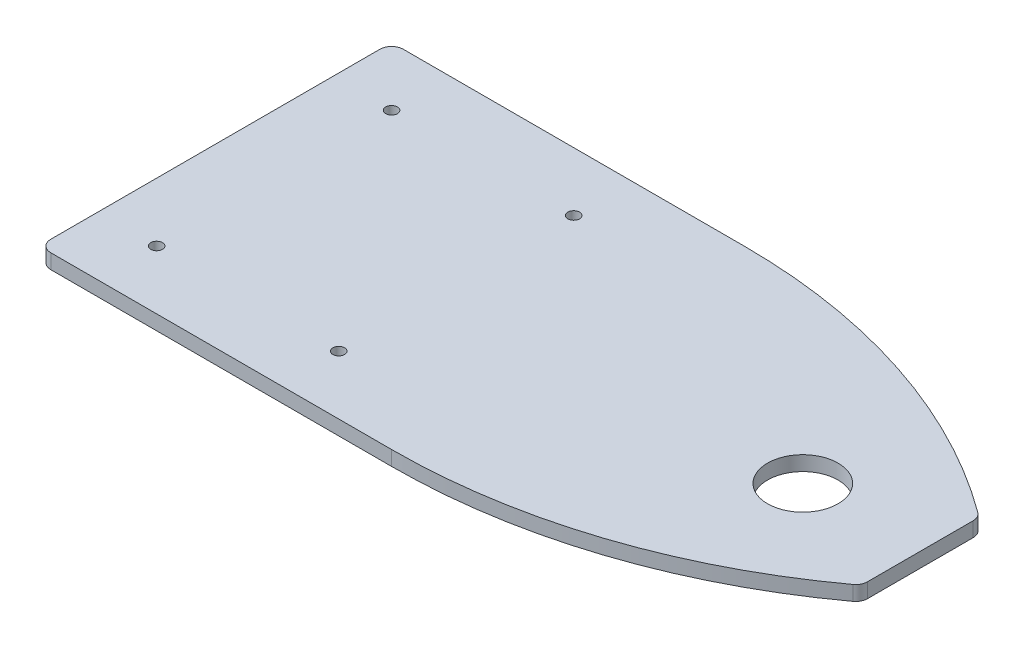
from build123d import *

# Parameters (mm, degrees)
SKETCH1_W           = 152.4
SKETCH1_H           = 76.2
BOSS_EXTRUDE1_DEPTH = 3.175
CUT_EXTRUDE1_DEPTH  = 3.175
FILLET2_R           = 2.54
FILLET3_R           = 2.54
SKETCH5_R           = 7.62
CUT_EXTRUDE2_DEPTH  = 3.175
SKETCH6_R           = 1.27
CUT_EXTRUDE3_DEPTH  = 3.175


with BuildPart() as part:
    # Sketch1 → Boss-Extrude1 (new body)
    with BuildSketch(Plane(origin=(0, 0, 0), x_dir=(1, 0, 0), z_dir=(0, 1, 0))):
        Rectangle(SKETCH1_W, SKETCH1_H)
    extrude(amount=BOSS_EXTRUDE1_DEPTH)

    # Sketch4 → Cut-Extrude1 (cut)
    with BuildSketch(Plane(origin=(0, 3.175, 0), x_dir=(1, 0, 0), z_dir=(0, 1, 0))):
        with BuildLine():
            Line((0, 38.1), (76.2, 38.1))
            Line((76.2, 38.1), (76.2, 12.7))
            ThreePointArc((76.2, 12.7), (40.160926284, 31.582778852), (0, 38.1))
        make_face()
        with BuildLine():
            Line((76.2, -38.1), (76.2, -12.7))
            ThreePointArc((76.2, -12.7), (40.160926284, -31.582778852), (0, -38.1))
            Line((0, -38.1), (76.2, -38.1))
        make_face()
    extrude(amount=-CUT_EXTRUDE1_DEPTH, mode=Mode.SUBTRACT)

    # Fillet2
    fillet2_edges = [part.edges().sort_by_distance(p)[0] for p in [
        (76.2, 1.5875, 12.7),
        (76.2, 1.5875, -12.7),
    ]]
    fillet(fillet2_edges, radius=FILLET2_R)

    # Fillet3
    fillet3_edges = [part.edges().sort_by_distance(p)[0] for p in [
        (-76.2, 1.5875, 38.1),
        (-76.2, 1.5875, -38.1),
    ]]
    fillet(fillet3_edges, radius=FILLET3_R)

    # Sketch5 → Cut-Extrude2 (cut)
    with BuildSketch(Plane(origin=(0, 3.175, 0), x_dir=(1, 0, 0), z_dir=(0, 1, 0))):
        with Locations((50.8, 0)):
            Circle(SKETCH5_R)
    extrude(amount=-CUT_EXTRUDE2_DEPTH, mode=Mode.SUBTRACT)

    # Sketch6 → Cut-Extrude3 (cut)
    with BuildSketch(Plane(origin=(0, 3.175, 0), x_dir=(1, 0, 0), z_dir=(0, 1, 0))):
        with Locations((-63.5, 25.4)):
            Circle(SKETCH6_R)
        with Locations((-63.5, -25.4)):
            Circle(SKETCH6_R)
        with Locations((-24.13, 25.4)):
            Circle(SKETCH6_R)
        with Locations((-24.13, -25.4)):
            Circle(SKETCH6_R)
    extrude(amount=-CUT_EXTRUDE3_DEPTH, mode=Mode.SUBTRACT)


solid = part.part
